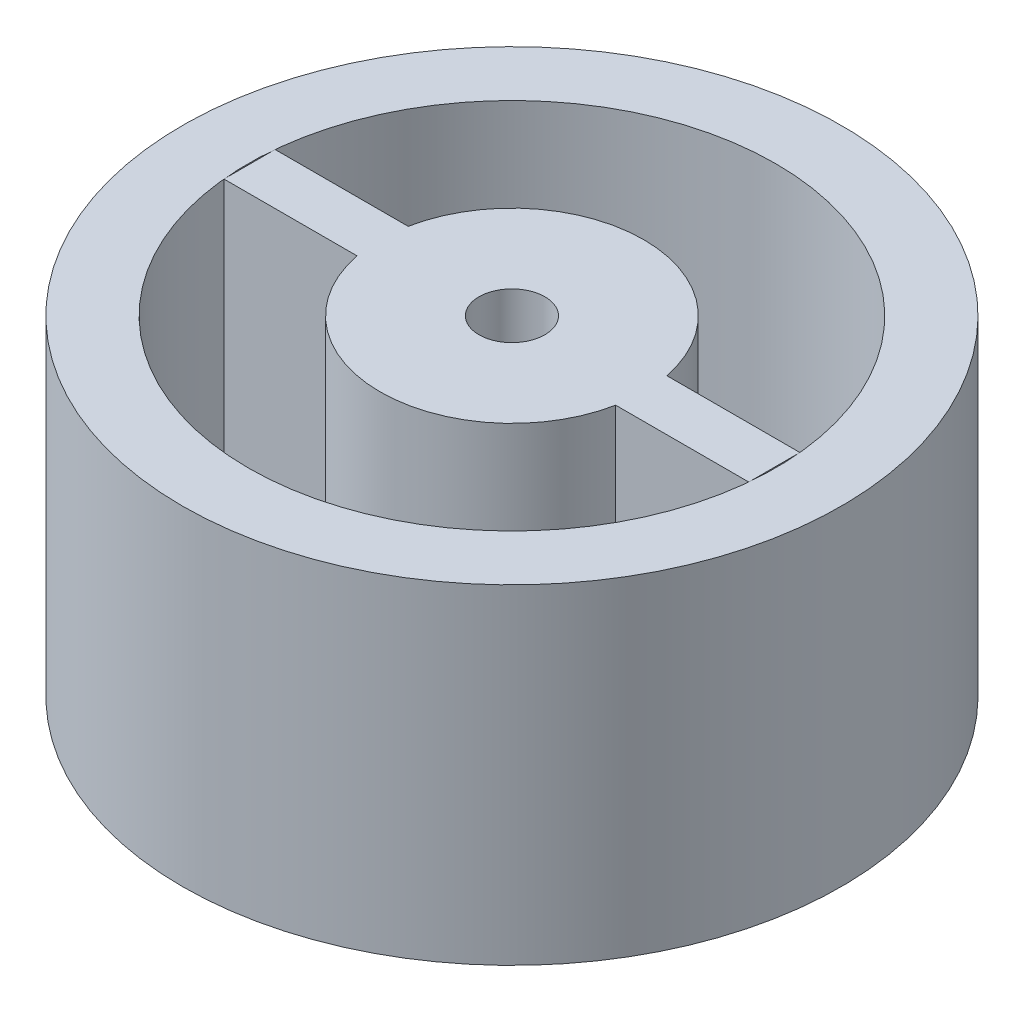
from build123d import *

# Parameters (mm, degrees)
SKETCH2_R               = 5
SKETCH2_R_2             = 0.5
BOSS_EXTRUDE1_DEPTH     = 5
CUT_EXTRUDE1_DEPTH      = 9.660254038
CUT_EXTRUDE1_DEPTH_BACK = 9.660254038
SKETCH4_R               = 4
SKETCH4_R_2             = 2
SKETCH5_W               = 7.962318844
SKETCH5_H               = 0.775550536
BOSS_EXTRUDE2_DEPTH     = 5
CUT_EXTRUDE2_DEPTH      = 9.660254038
CUT_EXTRUDE2_DEPTH_BACK = 9.660254038
SKETCH6_R               = 0.5


with BuildPart() as part:
    # Sketch2 → Boss-Extrude1 (new body)
    with BuildSketch(Plane(origin=(0, 0, 0), x_dir=(1, 0, 0), z_dir=(0, 1, 0))):
        Circle(SKETCH2_R)
        Circle(SKETCH2_R_2, mode=Mode.SUBTRACT)
    extrude(amount=BOSS_EXTRUDE1_DEPTH)

    # Sketch4 → Cut-Extrude1 (cut, two sides: drawn at the far end of the back side and taken through both)
    with BuildSketch(Plane.XZ.offset(-CUT_EXTRUDE1_DEPTH_BACK)):
        Circle(SKETCH4_R)
        Circle(SKETCH4_R_2, mode=Mode.SUBTRACT)
    extrude(amount=CUT_EXTRUDE1_DEPTH + CUT_EXTRUDE1_DEPTH_BACK, mode=Mode.SUBTRACT)


with BuildPart() as cut_extrude1_piece_1:
    # of the separate pieces the step leaves, piece 1, a body of its own (cut_extrude1_pieces)
    add(part.part.solids().sort_by_distance((5, 0, 0))[0])


with BuildPart() as cut_extrude1_piece_2:
    # of the separate pieces the step leaves, piece 2, a body of its own (cut_extrude1_pieces)
    add(part.part.solids().sort_by_distance((2, 0, 0))[0])

    # Sketch5 → Boss-Extrude2 (add)
    with BuildSketch(Plane.XZ):
        Rectangle(SKETCH5_W, SKETCH5_H)
    extrude(amount=-BOSS_EXTRUDE2_DEPTH)

    # Sketch6 → Cut-Extrude2 (cut, two sides: drawn at the far end of the back side and taken through both)
    with BuildSketch(Plane.XZ.offset(-CUT_EXTRUDE2_DEPTH_BACK)):
        Circle(SKETCH6_R)
    extrude(amount=CUT_EXTRUDE2_DEPTH + CUT_EXTRUDE2_DEPTH_BACK, mode=Mode.SUBTRACT)


solid = Compound([cut_extrude1_piece_1.part, cut_extrude1_piece_2.part])
